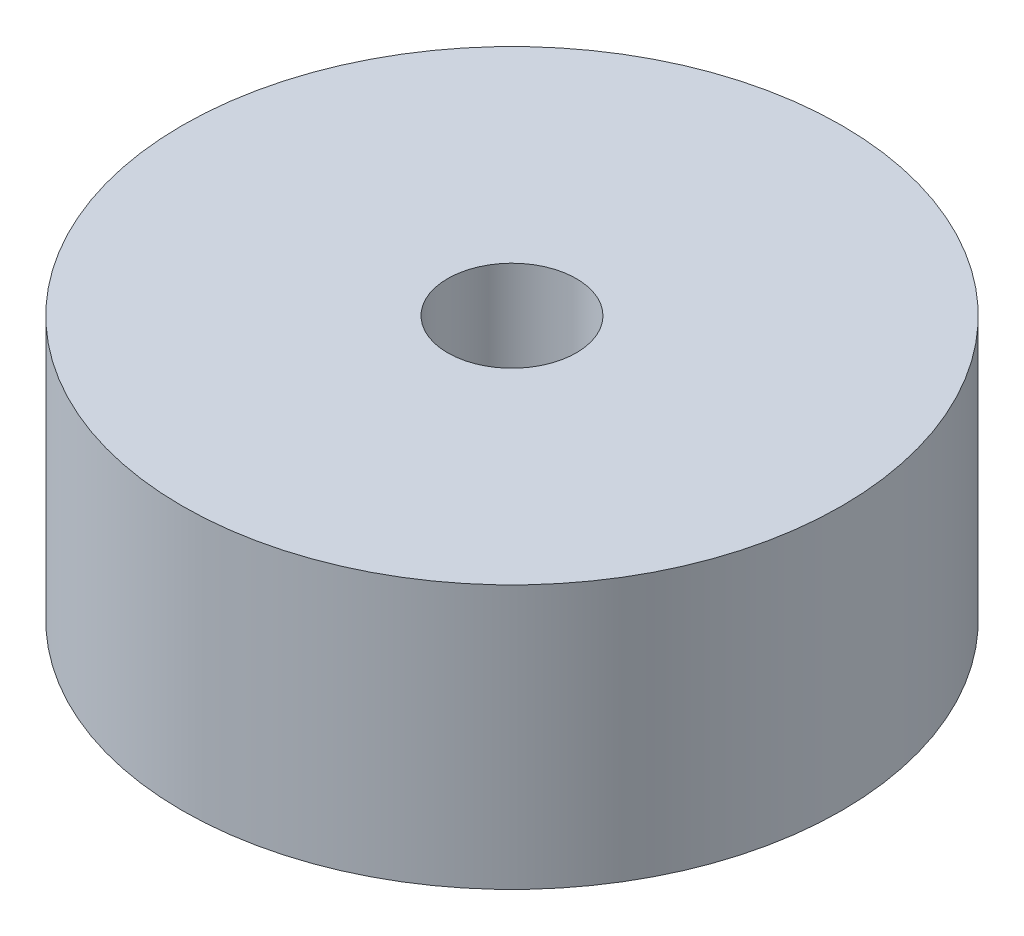
from build123d import *

# Parameters (mm, degrees)
SKETCH1_R           = 7.9375
SKETCH1_R_2         = 1.5494
BOSS_EXTRUDE1_DEPTH = 6.35


with BuildPart() as part:
    # Sketch1 → Boss-Extrude1 (new body)
    with BuildSketch(Plane(origin=(0, 0, 0), x_dir=(1, 0, 0), z_dir=(0, 1, 0))):
        Circle(SKETCH1_R)
        Circle(SKETCH1_R_2, mode=Mode.SUBTRACT)
    extrude(amount=BOSS_EXTRUDE1_DEPTH)


solid = part.part
